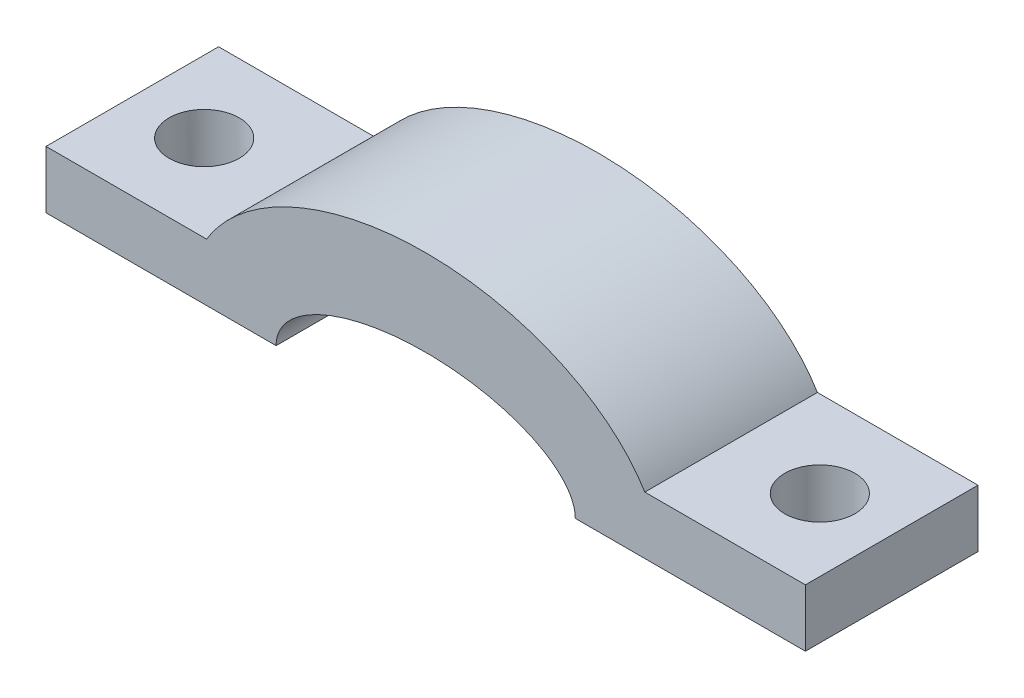
from build123d import *

# Parameters (mm, degrees)
BOSS_EXTRUDE1_DEPTH = 15
SKETCH3_W           = 20
SKETCH3_H           = 15
BOSS_EXTRUDE2_DEPTH = 5
SKETCH5_R           = 3.05
CUT_EXTRUDE2_DEPTH  = 10


with BuildPart() as part:
    # Sketch2 → Boss-Extrude1 (new body)
    with BuildSketch(Plane.XY):
        with BuildLine():
            add(Edge.make_bspline(
                [(13, 0), (13, 6), (0, 6), (-13, 6), (-13, 0)],
                knots=[0, 0, 0, 1.570796327, 1.570796327, 3.141592654, 3.141592654, 3.141592654], degree=2, weights=[1, 0.707106781, 1, 0.707106781, 1]))
            Line((13, 0), (20.5, 0))
            add(Edge.make_bspline(
                [(20.5, 0), (20.5, 13.5), (0, 13.5), (-20.5, 13.5), (-20.5, 0)],
                knots=[0, 0, 0, 1.570796327, 1.570796327, 3.141592654, 3.141592654, 3.141592654], degree=2, weights=[1, 0.707106781, 1, 0.707106781, 1]))
            Line((-20.5, 0), (-13, 0))
        make_face()
    extrude(amount=BOSS_EXTRUDE1_DEPTH)

    # Sketch3 → Boss-Extrude2 (add)
    with BuildSketch(Plane.XZ):
        with Locations((23, 7.5)):
            Rectangle(SKETCH3_W, SKETCH3_H)
        with Locations((-23, 7.5)):
            Rectangle(SKETCH3_W, SKETCH3_H)
    extrude(amount=-BOSS_EXTRUDE2_DEPTH)

    # Sketch5 → Cut-Extrude2 (cut)
    with BuildSketch(Plane(origin=(0, 5, 0), x_dir=(1, 0, 0), z_dir=(0, 1, 0))):
        with Locations((26.752125347, -7.5)):
            Circle(SKETCH5_R)
        with Locations((-26.752125347, -7.5)):
            Circle(SKETCH5_R)
    extrude(amount=-CUT_EXTRUDE2_DEPTH, mode=Mode.SUBTRACT)


solid = part.part
